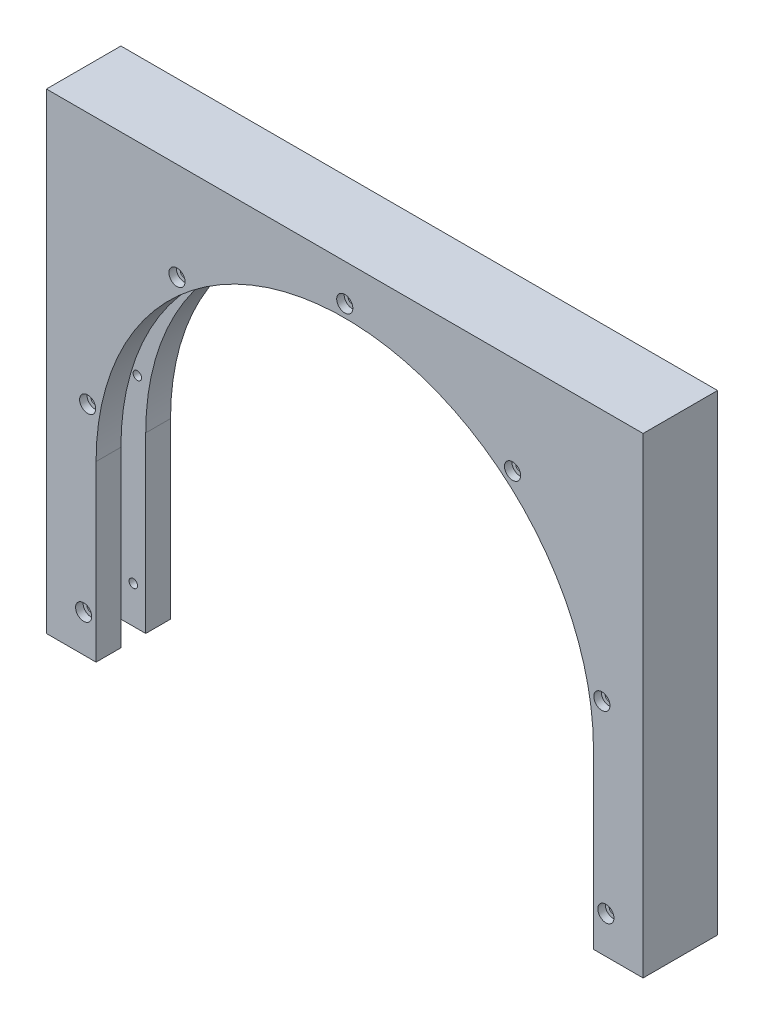
from build123d import *

# Parameters (mm, degrees)
BOSS_EXTRUDE1_DEPTH            = 15
CUT_EXTRUDE1_DEPTH             = 5
CBORE_FOR_M3_SHCS1_D           = 3.4
CBORE_FOR_M3_SHCS1_CBORE_D     = 6.5
CBORE_FOR_M3_SHCS1_CBORE_DEPTH = 3
CRVPATTERN1_START              = -15
CRVPATTERN1_OUTLINE_R          = 1.7
CRVPATTERN1_DEPTH              = 30
CRVPATTERN1_START_2            = 12
CRVPATTERN1_2_OUTLINE_R        = 3.25
CRVPATTERN1_2_OUTLINE_R_2      = 1.7
CRVPATTERN1_2_DEPTH            = 3


# Read off the part's stored shape, not the designer's step: CrvPattern1
with BuildPart() as part:
    # Sketch1 → Boss-Extrude1 (new, symmetric)
    with BuildSketch(Plane.XY):
        with BuildLine():
            Line((-100.2, 0), (-100.2, -70))
            Line((-100.2, -70), (-120.2, -70))
            Line((-120.2, -70), (-120.2, 120))
            Line((-120.2, 120), (120.2, 120))
            Line((120.2, 120), (120.2, -70))
            Line((120.2, -70), (100.2, -70))
            Line((100.2, -70), (100.2, 0))
            ThreePointArc((100.2, 0), (0, 100.2), (-100.2, 0))
        make_face()
    extrude(amount=BOSS_EXTRUDE1_DEPTH, both=True)

    # Sketch2 → Cut-Extrude1 (cut, symmetric)
    with BuildSketch(Plane.XY):
        with BuildLine():
            Line((-110.2, -70), (-110.2, 0))
            ThreePointArc((-110.2, 0), (0, 110.2), (110.2, 0))
            Line((110.2, 0), (110.2, -70))
            Line((110.2, -70), (100.2, -70))
            Line((100.2, -70), (100.2, 0))
            ThreePointArc((100.2, 0), (0, 100.2), (-100.2, 0))
            Line((-100.2, 0), (-100.2, -70))
            Line((-100.2, -70), (-110.2, -70))
        make_face()
    extrude(amount=CUT_EXTRUDE1_DEPTH, both=True, mode=Mode.SUBTRACT)

    # CBORE for M3 SHCS1 (through all)
    with Locations(Plane.XY.offset(15)):
        with Locations((-105.2, -55)):
            CounterBoreHole(CBORE_FOR_M3_SHCS1_D / 2, CBORE_FOR_M3_SHCS1_CBORE_D / 2, CBORE_FOR_M3_SHCS1_CBORE_DEPTH)

    # CrvPattern1 outline → CrvPattern1 (cut)
    with BuildSketch(Plane.XY.offset(CRVPATTERN1_START)):
        with Locations((-103.59220022, 18.322010084)):
            Circle(CRVPATTERN1_OUTLINE_R)
        with Locations((-67.600164716, 80.605568855)):
            Circle(CRVPATTERN1_OUTLINE_R)
        with Locations((0, 105.2)):
            Circle(CRVPATTERN1_OUTLINE_R)
        with Locations((67.600164716, 80.605568855)):
            Circle(CRVPATTERN1_OUTLINE_R)
        with Locations((103.59220022, 18.322010084)):
            Circle(CRVPATTERN1_OUTLINE_R)
        with Locations((105.2, -55)):
            Circle(CRVPATTERN1_OUTLINE_R)
    extrude(amount=CRVPATTERN1_DEPTH, mode=Mode.SUBTRACT)

    # CrvPattern1 2 outline → CrvPattern1 2 (cut)
    # profile 1 of 6: a face of its own
    with BuildSketch(Plane.XY.offset(CRVPATTERN1_START_2)):
        with Locations((-103.59220022, 18.322010084)):
            Circle(CRVPATTERN1_2_OUTLINE_R)
        with Locations((-103.59220022, 18.322010084)):
            Circle(CRVPATTERN1_2_OUTLINE_R_2, mode=Mode.SUBTRACT)
    # profile 2 of 6: a face of its own
    with BuildSketch(Plane.XY.offset(CRVPATTERN1_START_2)):
        with Locations((-67.600164716, 80.605568855)):
            Circle(CRVPATTERN1_2_OUTLINE_R)
        with Locations((-67.600164716, 80.605568855)):
            Circle(CRVPATTERN1_2_OUTLINE_R_2, mode=Mode.SUBTRACT)
    # profile 3 of 6: a face of its own
    with BuildSketch(Plane.XY.offset(CRVPATTERN1_START_2)):
        with Locations((0, 105.2)):
            Circle(CRVPATTERN1_2_OUTLINE_R)
        with Locations((0, 105.2)):
            Circle(CRVPATTERN1_2_OUTLINE_R_2, mode=Mode.SUBTRACT)
    # profile 4 of 6: a face of its own
    with BuildSketch(Plane.XY.offset(CRVPATTERN1_START_2)):
        with Locations((67.600164716, 80.605568855)):
            Circle(CRVPATTERN1_2_OUTLINE_R)
        with Locations((67.600164716, 80.605568855)):
            Circle(CRVPATTERN1_2_OUTLINE_R_2, mode=Mode.SUBTRACT)
    # profile 5 of 6: a face of its own
    with BuildSketch(Plane.XY.offset(CRVPATTERN1_START_2)):
        with Locations((103.59220022, 18.322010084)):
            Circle(CRVPATTERN1_2_OUTLINE_R)
        with Locations((103.59220022, 18.322010084)):
            Circle(CRVPATTERN1_2_OUTLINE_R_2, mode=Mode.SUBTRACT)
    # profile 6 of 6: a face of its own
    with BuildSketch(Plane.XY.offset(CRVPATTERN1_START_2)):
        with Locations((105.2, -55)):
            Circle(CRVPATTERN1_2_OUTLINE_R)
        with Locations((105.2, -55)):
            Circle(CRVPATTERN1_2_OUTLINE_R_2, mode=Mode.SUBTRACT)
    extrude(amount=CRVPATTERN1_2_DEPTH, mode=Mode.SUBTRACT)


solid = part.part
